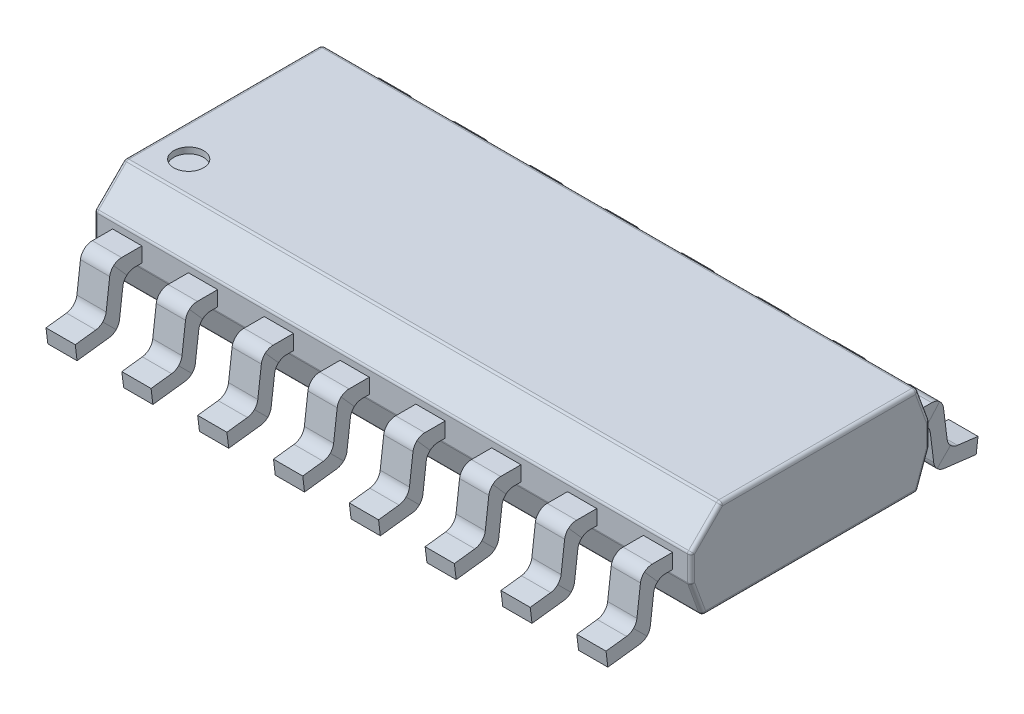
from build123d import *
from OCP.BRepFilletAPI import BRepFilletAPI_MakeChamfer

# Parameters (mm, degrees)
BOSS_EXTRUDE1_START    = 0.25
SKETCH1_W              = 10
SKETCH1_H              = 4
BOSS_EXTRUDE1_DEPTH    = 1.5
SKETCH12_W             = 0.49
SKETCH12_H             = 0.25
FILLET1_R              = 0.2
LPATTERN1_COUNT        = 8
LPATTERN1_PITCH        = 1.27
FILLET1_OF_LPATTERN1_R = 0.2
MIRROR1_START          = -4.69
MIRROR1_DEPTH          = 0.49
MIRROR1_START_2        = -3.42
MIRROR1_2_DEPTH        = 0.49
MIRROR1_START_3        = -2.15
MIRROR1_3_DEPTH        = 0.49
MIRROR1_START_4        = -0.88
MIRROR1_4_DEPTH        = 0.49
MIRROR1_START_5        = 0.39
MIRROR1_5_DEPTH        = 0.49
MIRROR1_START_6        = 1.66
MIRROR1_6_DEPTH        = 0.49
MIRROR1_START_7        = 2.93
MIRROR1_7_DEPTH        = 0.49
MIRROR1_START_8        = 4.2
MIRROR1_8_DEPTH        = 0.49
CHAMFER1_START         = 2.298097039
CHAMFER1_OUTLINE_W     = 10
CHAMFER1_OUTLINE_H     = 0.707106781
CHAMFER1_DEPTH         = 1.701902961
CHAMFER2_SIZE          = 0.2
CHAMFER2_SIZE2         = 0.549495484
FILLET2_R              = 0.06
SKETCH14_R             = 0.25
CUT_EXTRUDE2_DEPTH     = 0.1


with BuildPart() as part:
    # Sketch1 → Boss-Extrude1 (new body)
    with BuildSketch(Plane(origin=(0, 0, 0), x_dir=(1, 0, 0), z_dir=(0, 1, 0)).offset(BOSS_EXTRUDE1_START)):
        Rectangle(SKETCH1_W, SKETCH1_H)
    extrude(amount=BOSS_EXTRUDE1_DEPTH)

    # Sweep1: sweep along a path in Sketch4
    with BuildLine(Plane(origin=(4.445, 0, 0), x_dir=(0, 0, -1), z_dir=(1, 0, 0))) as sweep1_path:
        Line((-2, 1), (-2.406014023, 1))
        Line((-2.406014023, 1), (-2.504472309, 0.198121606))
        Line((-2.504472309, 0.198121606), (-3.1, 0.125))
    # Sketch12 → Sweep1 (sweep)
    with BuildSketch(Plane.XY.offset(2)):
        with Locations((4.445, 1)):
            Rectangle(SKETCH12_W, SKETCH12_H)
    sweep1 = sweep(path=sweep1_path.line, transition=Transition.RIGHT)

    # Fillet1
    fillet1_edges = [part.edges().sort_by_distance(p)[0] for p in [
        (4.445, 0.085955183, 2.392305886),
        (4.445, 0.310288029, 2.616638732),
        (4.445, 0.875, 2.295423364),
        (4.445, 1.125, 2.516604681),
    ]]
    fillet(fillet1_edges, radius=FILLET1_R)

    # LPattern1: Sweep1 ×8
    with Locations(*[(-i * LPATTERN1_PITCH, 0, 0) for i in range(1, LPATTERN1_COUNT)]):
        add(sweep1)

    # Fillet1 of LPattern1
    fillet1_of_lpattern1_edges = [part.edges().sort_by_distance(p)[0] for p in [
        (3.175, 0.085955183, 2.392305886),
        (3.175, 0.310288029, 2.616638732),
        (3.175, 0.875, 2.295423364),
        (3.175, 1.125, 2.516604681),
        (1.905, 0.085955183, 2.392305886),
        (1.905, 0.310288029, 2.616638732),
        (1.905, 0.875, 2.295423364),
        (1.905, 1.125, 2.516604681),
        (0.635, 0.085955183, 2.392305886),
        (0.635, 0.310288029, 2.616638732),
        (0.635, 0.875, 2.295423364),
        (0.635, 1.125, 2.516604681),
        (-0.635, 0.085955183, 2.392305886),
        (-0.635, 0.310288029, 2.616638732),
        (-0.635, 0.875, 2.295423364),
        (-0.635, 1.125, 2.516604681),
        (-1.905, 0.085955183, 2.392305886),
        (-1.905, 0.310288029, 2.616638732),
        (-1.905, 0.875, 2.295423364),
        (-1.905, 1.125, 2.516604681),
        (-3.175, 0.085955183, 2.392305886),
        (-3.175, 0.310288029, 2.616638732),
        (-3.175, 0.875, 2.295423364),
        (-3.175, 1.125, 2.516604681),
        (-4.445, 0.085955183, 2.392305886),
        (-4.445, 0.310288029, 2.616638732),
        (-4.445, 0.875, 2.295423364),
        (-4.445, 1.125, 2.516604681),
    ]]
    fillet(fillet1_of_lpattern1_edges, radius=FILLET1_OF_LPATTERN1_R)

    # Mirror1: read off the stored shape, not the designer's step
    # Mirror1 outline → Mirror1 (add)
    with BuildSketch(Plane.YZ.offset(MIRROR1_START)):
        with BuildLine():
            Line((1.125, -2), (0.875, -2))
            Line((0.875, -2), (0.875, -2.118478312))
            ThreePointArc((0.875, -2.118478312), (0.824791144, -2.251002321), (0.699373869, -2.316987542))
            Line((0.699373869, -2.316987542), (0.241047591, -2.373262933))
            ThreePointArc((0.241047591, -2.373262933), (0.124000104, -2.430350807), (0.06691223, -2.547398294))
            Line((0.06691223, -2.547398294), (0.000931731, -3.084766332))
            Line((0.000931731, -3.084766332), (0.249068269, -3.115233668))
            Line((0.249068269, -3.115233668), (0.291245076, -2.771731141))
            ThreePointArc((0.291245076, -2.771731141), (0.34833295, -2.654683653), (0.465380438, -2.597595779))
            Line((0.465380438, -2.597595779), (0.949373869, -2.538168858))
            ThreePointArc((0.949373869, -2.538168858), (1.074791144, -2.472183637), (1.125, -2.339659628))
            Line((1.125, -2.339659628), (1.125, -2))
        make_face()
    extrude(amount=MIRROR1_DEPTH)

    # Mirror1 2 outline → Mirror1 2 (add)
    with BuildSketch(Plane.YZ.offset(MIRROR1_START_2)):
        with BuildLine():
            Line((1.125, -2), (0.875, -2))
            Line((0.875, -2), (0.875, -2.118478312))
            ThreePointArc((0.875, -2.118478312), (0.824791144, -2.251002321), (0.699373869, -2.316987542))
            Line((0.699373869, -2.316987542), (0.241047591, -2.373262933))
            ThreePointArc((0.241047591, -2.373262933), (0.124000104, -2.430350807), (0.06691223, -2.547398294))
            Line((0.06691223, -2.547398294), (0.000931731, -3.084766332))
            Line((0.000931731, -3.084766332), (0.249068269, -3.115233668))
            Line((0.249068269, -3.115233668), (0.291245076, -2.771731141))
            ThreePointArc((0.291245076, -2.771731141), (0.34833295, -2.654683653), (0.465380438, -2.597595779))
            Line((0.465380438, -2.597595779), (0.949373869, -2.538168858))
            ThreePointArc((0.949373869, -2.538168858), (1.074791144, -2.472183637), (1.125, -2.339659628))
            Line((1.125, -2.339659628), (1.125, -2))
        make_face()
    extrude(amount=MIRROR1_2_DEPTH)

    # Mirror1 3 outline → Mirror1 3 (add)
    with BuildSketch(Plane.YZ.offset(MIRROR1_START_3)):
        with BuildLine():
            Line((1.125, -2), (0.875, -2))
            Line((0.875, -2), (0.875, -2.118478312))
            ThreePointArc((0.875, -2.118478312), (0.824791144, -2.251002321), (0.699373869, -2.316987542))
            Line((0.699373869, -2.316987542), (0.241047591, -2.373262933))
            ThreePointArc((0.241047591, -2.373262933), (0.124000104, -2.430350807), (0.06691223, -2.547398294))
            Line((0.06691223, -2.547398294), (0.000931731, -3.084766332))
            Line((0.000931731, -3.084766332), (0.249068269, -3.115233668))
            Line((0.249068269, -3.115233668), (0.291245076, -2.771731141))
            ThreePointArc((0.291245076, -2.771731141), (0.34833295, -2.654683653), (0.465380438, -2.597595779))
            Line((0.465380438, -2.597595779), (0.949373869, -2.538168858))
            ThreePointArc((0.949373869, -2.538168858), (1.074791144, -2.472183637), (1.125, -2.339659628))
            Line((1.125, -2.339659628), (1.125, -2))
        make_face()
    extrude(amount=MIRROR1_3_DEPTH)

    # Mirror1 4 outline → Mirror1 4 (add)
    with BuildSketch(Plane.YZ.offset(MIRROR1_START_4)):
        with BuildLine():
            Line((1.125, -2), (0.875, -2))
            Line((0.875, -2), (0.875, -2.118478312))
            ThreePointArc((0.875, -2.118478312), (0.824791144, -2.251002321), (0.699373869, -2.316987542))
            Line((0.699373869, -2.316987542), (0.241047591, -2.373262933))
            ThreePointArc((0.241047591, -2.373262933), (0.124000104, -2.430350807), (0.06691223, -2.547398294))
            Line((0.06691223, -2.547398294), (0.000931731, -3.084766332))
            Line((0.000931731, -3.084766332), (0.249068269, -3.115233668))
            Line((0.249068269, -3.115233668), (0.291245076, -2.771731141))
            ThreePointArc((0.291245076, -2.771731141), (0.34833295, -2.654683653), (0.465380438, -2.597595779))
            Line((0.465380438, -2.597595779), (0.949373869, -2.538168858))
            ThreePointArc((0.949373869, -2.538168858), (1.074791144, -2.472183637), (1.125, -2.339659628))
            Line((1.125, -2.339659628), (1.125, -2))
        make_face()
    extrude(amount=MIRROR1_4_DEPTH)

    # Mirror1 5 outline → Mirror1 5 (add)
    with BuildSketch(Plane.YZ.offset(MIRROR1_START_5)):
        with BuildLine():
            Line((1.125, -2), (0.875, -2))
            Line((0.875, -2), (0.875, -2.118478312))
            ThreePointArc((0.875, -2.118478312), (0.824791144, -2.251002321), (0.699373869, -2.316987542))
            Line((0.699373869, -2.316987542), (0.241047591, -2.373262933))
            ThreePointArc((0.241047591, -2.373262933), (0.124000104, -2.430350807), (0.06691223, -2.547398294))
            Line((0.06691223, -2.547398294), (0.000931731, -3.084766332))
            Line((0.000931731, -3.084766332), (0.249068269, -3.115233668))
            Line((0.249068269, -3.115233668), (0.291245076, -2.771731141))
            ThreePointArc((0.291245076, -2.771731141), (0.34833295, -2.654683653), (0.465380438, -2.597595779))
            Line((0.465380438, -2.597595779), (0.949373869, -2.538168858))
            ThreePointArc((0.949373869, -2.538168858), (1.074791144, -2.472183637), (1.125, -2.339659628))
            Line((1.125, -2.339659628), (1.125, -2))
        make_face()
    extrude(amount=MIRROR1_5_DEPTH)

    # Mirror1 6 outline → Mirror1 6 (add)
    with BuildSketch(Plane.YZ.offset(MIRROR1_START_6)):
        with BuildLine():
            Line((1.125, -2), (0.875, -2))
            Line((0.875, -2), (0.875, -2.118478312))
            ThreePointArc((0.875, -2.118478312), (0.824791144, -2.251002321), (0.699373869, -2.316987542))
            Line((0.699373869, -2.316987542), (0.241047591, -2.373262933))
            ThreePointArc((0.241047591, -2.373262933), (0.124000104, -2.430350807), (0.06691223, -2.547398294))
            Line((0.06691223, -2.547398294), (0.000931731, -3.084766332))
            Line((0.000931731, -3.084766332), (0.249068269, -3.115233668))
            Line((0.249068269, -3.115233668), (0.291245076, -2.771731141))
            ThreePointArc((0.291245076, -2.771731141), (0.34833295, -2.654683653), (0.465380438, -2.597595779))
            Line((0.465380438, -2.597595779), (0.949373869, -2.538168858))
            ThreePointArc((0.949373869, -2.538168858), (1.074791144, -2.472183637), (1.125, -2.339659628))
            Line((1.125, -2.339659628), (1.125, -2))
        make_face()
    extrude(amount=MIRROR1_6_DEPTH)

    # Mirror1 7 outline → Mirror1 7 (add)
    with BuildSketch(Plane.YZ.offset(MIRROR1_START_7)):
        with BuildLine():
            Line((1.125, -2), (0.875, -2))
            Line((0.875, -2), (0.875, -2.118478312))
            ThreePointArc((0.875, -2.118478312), (0.824791144, -2.251002321), (0.699373869, -2.316987542))
            Line((0.699373869, -2.316987542), (0.241047591, -2.373262933))
            ThreePointArc((0.241047591, -2.373262933), (0.124000104, -2.430350807), (0.06691223, -2.547398294))
            Line((0.06691223, -2.547398294), (0.000931731, -3.084766332))
            Line((0.000931731, -3.084766332), (0.249068269, -3.115233668))
            Line((0.249068269, -3.115233668), (0.291245076, -2.771731141))
            ThreePointArc((0.291245076, -2.771731141), (0.34833295, -2.654683653), (0.465380438, -2.597595779))
            Line((0.465380438, -2.597595779), (0.949373869, -2.538168858))
            ThreePointArc((0.949373869, -2.538168858), (1.074791144, -2.472183637), (1.125, -2.339659628))
            Line((1.125, -2.339659628), (1.125, -2))
        make_face()
    extrude(amount=MIRROR1_7_DEPTH)

    # Mirror1 8 outline → Mirror1 8 (add)
    with BuildSketch(Plane.YZ.offset(MIRROR1_START_8)):
        with BuildLine():
            Line((1.125, -2), (0.875, -2))
            Line((0.875, -2), (0.875, -2.118478312))
            ThreePointArc((0.875, -2.118478312), (0.824791144, -2.251002321), (0.699373869, -2.316987542))
            Line((0.699373869, -2.316987542), (0.241047591, -2.373262933))
            ThreePointArc((0.241047591, -2.373262933), (0.124000104, -2.430350807), (0.06691223, -2.547398294))
            Line((0.06691223, -2.547398294), (0.000931731, -3.084766332))
            Line((0.000931731, -3.084766332), (0.249068269, -3.115233668))
            Line((0.249068269, -3.115233668), (0.291245076, -2.771731141))
            ThreePointArc((0.291245076, -2.771731141), (0.34833295, -2.654683653), (0.465380438, -2.597595779))
            Line((0.465380438, -2.597595779), (0.949373869, -2.538168858))
            ThreePointArc((0.949373869, -2.538168858), (1.074791144, -2.472183637), (1.125, -2.339659628))
            Line((1.125, -2.339659628), (1.125, -2))
        make_face()
    extrude(amount=MIRROR1_8_DEPTH)

    # Chamfer1: read off the stored shape, not the designer's step
    # Chamfer1 outline → Chamfer1 (cut)
    with BuildSketch(Plane(origin=(0, 0, 0), x_dir=(1, 0, 0), z_dir=(0, 0.7071067811865476, 0.7071067811865476)).offset(CHAMFER1_START)):
        with Locations((0, -0.176776695)):
            Rectangle(CHAMFER1_OUTLINE_W, CHAMFER1_OUTLINE_H)
    extrude(amount=CHAMFER1_DEPTH, mode=Mode.SUBTRACT)

    # Chamfer2: one chamfer whose edges measure the first distance from different faces: ONE call of the kernel's chamfer builder (chamfer() names one face for all edges)
    chamfer2_edges_1 = [part.edges().sort_by_distance(p)[0] for p in [
        (0, 0.25, 2),
        (0, 0.25, -2),
    ]]
    chamfer2_side_1 = [part.faces().sort_by_distance(p)[0] for p in [
        (0, 0.25, 0),
    ]]
    chamfer2_edges_2 = [part.edges().sort_by_distance(p)[0] for p in [
        (0, 1.75, -2),
    ]]
    chamfer2_side_2 = [part.faces().sort_by_distance(p)[0] for p in [
        (0, 1.75, -0.25),
    ]]
    chamfer2 = BRepFilletAPI_MakeChamfer(part.part.solid().wrapped)
    for e in chamfer2_edges_1:
        chamfer2.Add(CHAMFER2_SIZE, CHAMFER2_SIZE2, e.wrapped, chamfer2_side_1[0].wrapped)  # the first distance lies on this face
    for e in chamfer2_edges_2:
        chamfer2.Add(CHAMFER2_SIZE, CHAMFER2_SIZE2, e.wrapped, chamfer2_side_2[0].wrapped)  # the first distance lies on this face
    add(Compound.cast(chamfer2.Shape()), mode=Mode.REPLACE)

    # Fillet2
    fillet2_edges = [part.edges().sort_by_distance(p)[0] for p in [
        (5, 1.024747742, 2),
        (-5, 1.024747742, 2),
        (0, 1.25, 2),
        (5, 1.75, -0.15),
        (0, 1.75, 1.5),
        (5, 1.5, 1.75),
        (-5, 1.5, 1.75),
        (-5, 1.75, -0.15),
        (0, 1.75, -1.8),
        (-5, 1, -2),
        (-5, 0.25, 0),
        (-5, 0.524747742, 1.9),
        (-5, 0.524747742, -1.9),
        (-5, 1.475252258, -1.9),
        (5, 1, -2),
        (0, 0.799495484, -2),
        (0, 1.200504516, -2),
        (5, 0.25, 0),
        (5, 0.524747742, 1.9),
        (5, 0.524747742, -1.9),
        (5, 1.475252258, -1.9),
        (0, 0.25, 1.8),
        (0, 0.25, -1.8),
        (0, 0.799495484, 2),
    ]]
    fillet(fillet2_edges, radius=FILLET2_R)

    # Sketch14 → Cut-Extrude2 (cut)
    with BuildSketch(Plane(origin=(0, 1.75, 0), x_dir=(1, 0, 0), z_dir=(0, 1, 0))):
        with Locations(Location((-4.44, -0.975147186, 0), (0, 0, 270))):
            Circle(SKETCH14_R)
    extrude(amount=-CUT_EXTRUDE2_DEPTH, mode=Mode.SUBTRACT)


solid = part.part
